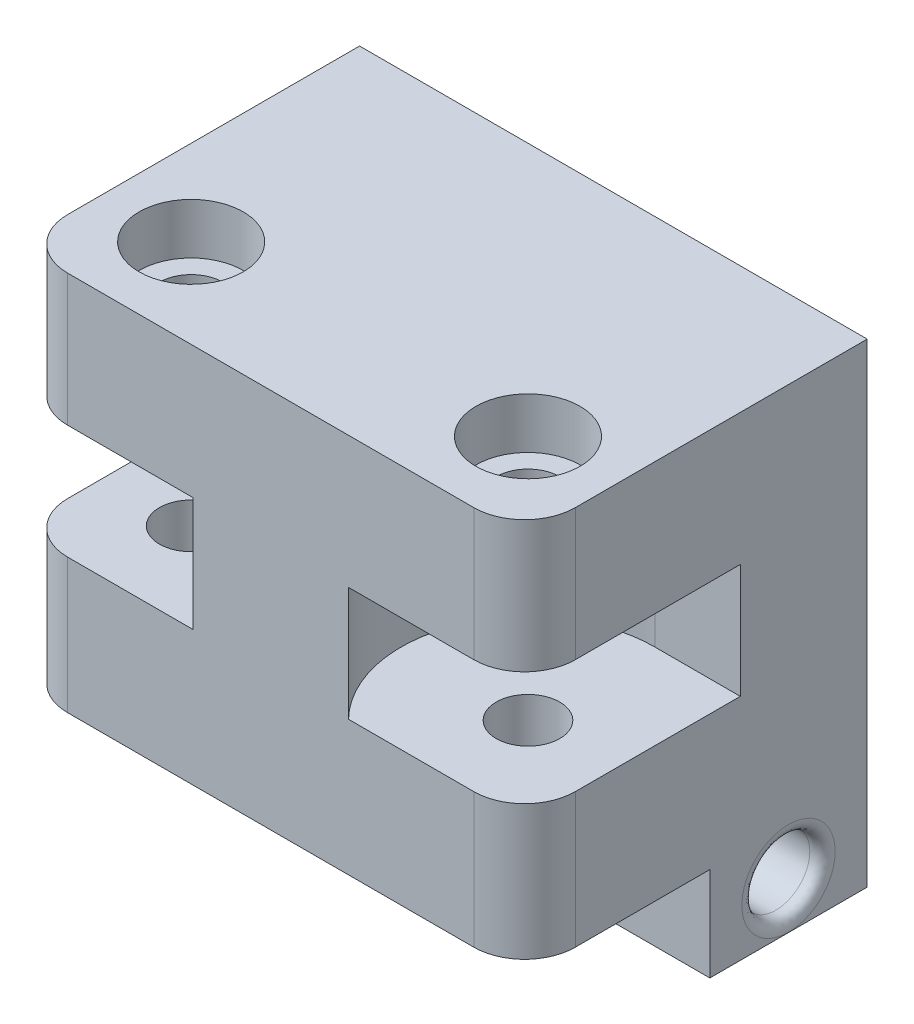
from build123d import *

# Parameters (mm, degrees)
SKETCH1_W           = 40
SKETCH1_H           = 27
BOSS_EXTRUDE1_DEPTH = 30
CUT_EXTRUDE1_DEPTH  = 10
SKETCH3_R           = 2.5
CUT_EXTRUDE2_DEPTH  = 30
CUT_EXTRUDE5_START  = -10.62
CUT_EXTRUDE5_DEPTH  = 9
SKETCH10_W          = 20
SKETCH10_H          = 9
CUT_EXTRUDE7_DEPTH  = 6.8
SKETCH12_W          = 20
SKETCH12_H          = 9
CUT_EXTRUDE10_DEPTH = 6.8
FILLET1_R           = 4
SKETCH13_W          = 12.4
SKETCH13_H          = 7.4
SKETCH13_R          = 2.675
BOSS_EXTRUDE2_DEPTH = 40
CUT_EXTRUDE11_REACH = 42.436
SKETCH14_W          = 20
SKETCH14_H          = 7.4
SKETCH15_R          = 4.1
CUT_EXTRUDE12_DEPTH = 4
SKETCH16_R          = 2.5
CUT_EXTRUDE13_DEPTH = 4
FILLET2_SIZE        = 1


with BuildPart() as part:
    # Sketch1 → Boss-Extrude1 (new body)
    with BuildSketch(Plane(origin=(0, 0, 0), x_dir=(1, 0, 0), z_dir=(0, 1, 0))):
        with Locations((-2.846153846, 4.313186813)):
            Rectangle(SKETCH1_W, SKETCH1_H)
    extrude(amount=BOSS_EXTRUDE1_DEPTH)

    # Sketch2 → Cut-Extrude1 (cut)
    with BuildSketch(Plane(origin=(0, 0, -17.813186813), x_dir=(-1, 0, 0), z_dir=(0, 0, -1))):
        Polygon((-8.086431081, 26), (-8.086431081, 4), (-0.206431081, 4), (-0.206431081, 7), (-2.866431081, 7), (-2.866431081, 8.008707537), (-0.253846154, 10.628707537), (5.946153846, 10.628707537), (8.558738773, 8.008707537), (8.558738773, 7), (5.898738773, 7), (5.898738773, 4), (13.778738773, 4), (13.778738773, 26), (5.898738773, 26), (5.898738773, 23), (8.558738773, 23), (8.558738773, 21.991292463), (5.938738773, 19.378707537), (-0.246431081, 19.378707537), (-2.866431081, 21.991292463), (-2.866431081, 23), (-0.206431081, 23), (-0.206431081, 26), align=None)
    extrude(amount=-CUT_EXTRUDE1_DEPTH, mode=Mode.SUBTRACT)

    # Sketch3 → Cut-Extrude2 (cut)
    with BuildSketch(Plane.XZ):
        with Locations(Location((10.423846154, 2.186813187, 0), (0, 0, 270))):
            Circle(SKETCH3_R)
        with Locations(Location((-16.116153846, 2.186813187, 0), (0, 0, 90))):
            Circle(SKETCH3_R)
    extrude(amount=-CUT_EXTRUDE2_DEPTH, mode=Mode.SUBTRACT)

    # Sketch8 → Cut-Extrude5 (cut)
    with BuildSketch(Plane.XZ.offset(CUT_EXTRUDE5_START)):
        with BuildLine():
            Line((3.282417725, 9.186813187), (17.153846154, 9.186813187))
            Line((17.153846154, 9.186813187), (17.153846154, -7.813186813))
            Line((17.153846154, -7.813186813), (10.423846154, -7.813186813))
            ThreePointArc((10.423846154, -7.813186813), (1.204301697, -1.686170159), (3.282417725, 9.186813187))
        make_face()
        with BuildLine():
            Line((-22.846153846, -7.813186813), (-16.116153846, -7.813186813))
            ThreePointArc((-16.116153846, -7.813186813), (-6.896609389, -1.686170159), (-8.974725418, 9.186813187))
            Line((-8.974725418, 9.186813187), (-22.846153846, 9.186813187))
            Line((-22.846153846, 9.186813187), (-22.846153846, -7.813186813))
        make_face()
    extrude(amount=-CUT_EXTRUDE5_DEPTH, mode=Mode.SUBTRACT)

    # Sketch10 → Cut-Extrude7 (cut)
    with BuildSketch(Plane.ZY.offset(-8.086431081)):
        with Locations((-7.813186813, 15.12)):
            Rectangle(SKETCH10_W, SKETCH10_H)
    extrude(amount=CUT_EXTRUDE7_DEPTH, mode=Mode.SUBTRACT)

    # Sketch12 → Cut-Extrude10 (cut)
    with BuildSketch(Plane(origin=(-13.778738773, 0, 0), x_dir=(0, 0, -1), z_dir=(1, 0, 0))):
        with Locations((7.813186813, 15.12)):
            Rectangle(SKETCH12_W, SKETCH12_H)
    extrude(amount=CUT_EXTRUDE10_DEPTH, mode=Mode.SUBTRACT)

    # Fillet1
    fillet1_edges = [part.edges().sort_by_distance(p)[0] for p in [
        (17.153846154, 24.81, 9.186813187),
        (-22.846153846, 24.81, 9.186813187),
        (17.153846154, 5.31, 9.186813187),
        (-22.846153846, 5.31, 9.186813187),
    ]]
    fillet(fillet1_edges, radius=FILLET1_R)

    # Sketch13 → Boss-Extrude2 (add)
    with BuildSketch(Plane(origin=(17.153846154, 0, 0), x_dir=(0, 0, -1), z_dir=(1, 0, 0))):
        with Locations((11.613186813, -3.7)):
            Rectangle(SKETCH13_W, SKETCH13_H)
        with Locations((11.613186813, -3.7)):
            Circle(SKETCH13_R, mode=Mode.SUBTRACT)
    extrude(amount=-BOSS_EXTRUDE2_DEPTH)

    # Sketch14 → Cut-Extrude11 (cut, up to next)
    with BuildSketch(Plane.XY.offset(-5.413186813), mode=Mode.PRIVATE) as cut_extrude11_sk1:
        with Locations((-2.846153846, -3.7)):
            Rectangle(SKETCH14_W, SKETCH14_H)
    cut_extrude11_tool1 = extrude(cut_extrude11_sk1.sketch, amount=-CUT_EXTRUDE11_REACH, mode=Mode.PRIVATE) & part.part
    add(cut_extrude11_tool1.solids().sort_by_distance((-2.846154, -3.7, -5.413187))[0], mode=Mode.SUBTRACT)

    # Sketch15 → Cut-Extrude12 (cut)
    with BuildSketch(Plane(origin=(0, 30, 0), x_dir=(1, 0, 0), z_dir=(0, 1, 0))):
        with Locations(Location((-16.116153846, -2.186813187, 0), (0, 0, 270))):
            Circle(SKETCH15_R)
        with Locations(Location((10.423846154, -2.186813187, 0), (0, 0, 90))):
            Circle(SKETCH15_R)
    extrude(amount=-CUT_EXTRUDE12_DEPTH, mode=Mode.SUBTRACT)

    # Sketch16 → Cut-Extrude13 (cut)
    # profile 1 of 2: a face of its own
    with BuildSketch(Plane.XZ):
        Polygon((-13.749017742, -1.913186813), (-11.381881639, 2.186813187), (-13.749017742, 6.286813187), (-18.48328995, 6.286813187), (-20.850426054, 2.186813187), (-18.48328995, -1.913186813), align=None)
        with Locations(Location((-16.116153846, 2.186813187, 0), (0, 0, 270))):
            Circle(SKETCH16_R, mode=Mode.SUBTRACT)
    # profile 2 of 2: a face of its own
    with BuildSketch(Plane.XZ):
        Polygon((12.790982258, -1.913186813), (15.158118361, 2.186813187), (12.790982258, 6.286813187), (8.05671005, 6.286813187), (5.689573946, 2.186813187), (8.05671005, -1.913186813), align=None)
        with Locations(Location((10.423846154, 2.186813187, 0), (0, 0, 270))):
            Circle(SKETCH16_R, mode=Mode.SUBTRACT)
    extrude(amount=-CUT_EXTRUDE13_DEPTH, mode=Mode.SUBTRACT)

    # Fillet2
    # a fillet whose section is not a circle: 1 mm, written as the material it takes off along each edge
    with BuildSketch(Plane(origin=(-22.846153846, -3.7, -11.613186813), x_dir=(0, 0, -1), z_dir=(0, -1, 0))) as fillet2_piece_1:
        with BuildLine():
            Bezier((2.675, FILLET2_SIZE), (2.675, 0), (2.675 + FILLET2_SIZE, 0), weights=[1, 1, 1])
            Line((2.675 + FILLET2_SIZE, 0), (2.675, 0))
            Line((2.675, 0), (2.675, FILLET2_SIZE))
        make_face()
    revolve(axis=Axis((-22.846153846, -3.7, -11.613186813), (1, 0, 0)), mode=Mode.SUBTRACT)
    with BuildSketch(Plane(origin=(17.153846154, -3.7, -11.613186813), x_dir=(0, 0, -1), z_dir=(0, -1, 0))) as fillet2_piece_2:
        with BuildLine():
            Bezier((2.675, -FILLET2_SIZE), (2.675, 0), (2.675 + FILLET2_SIZE, 0), weights=[1, 1, 1])
            Line((2.675 + FILLET2_SIZE, 0), (2.675, 0))
            Line((2.675, 0), (2.675, -FILLET2_SIZE))
        make_face()
    revolve(axis=Axis((17.153846154, -3.7, -11.613186813), (1, 0, 0)), mode=Mode.SUBTRACT)


solid = part.part
